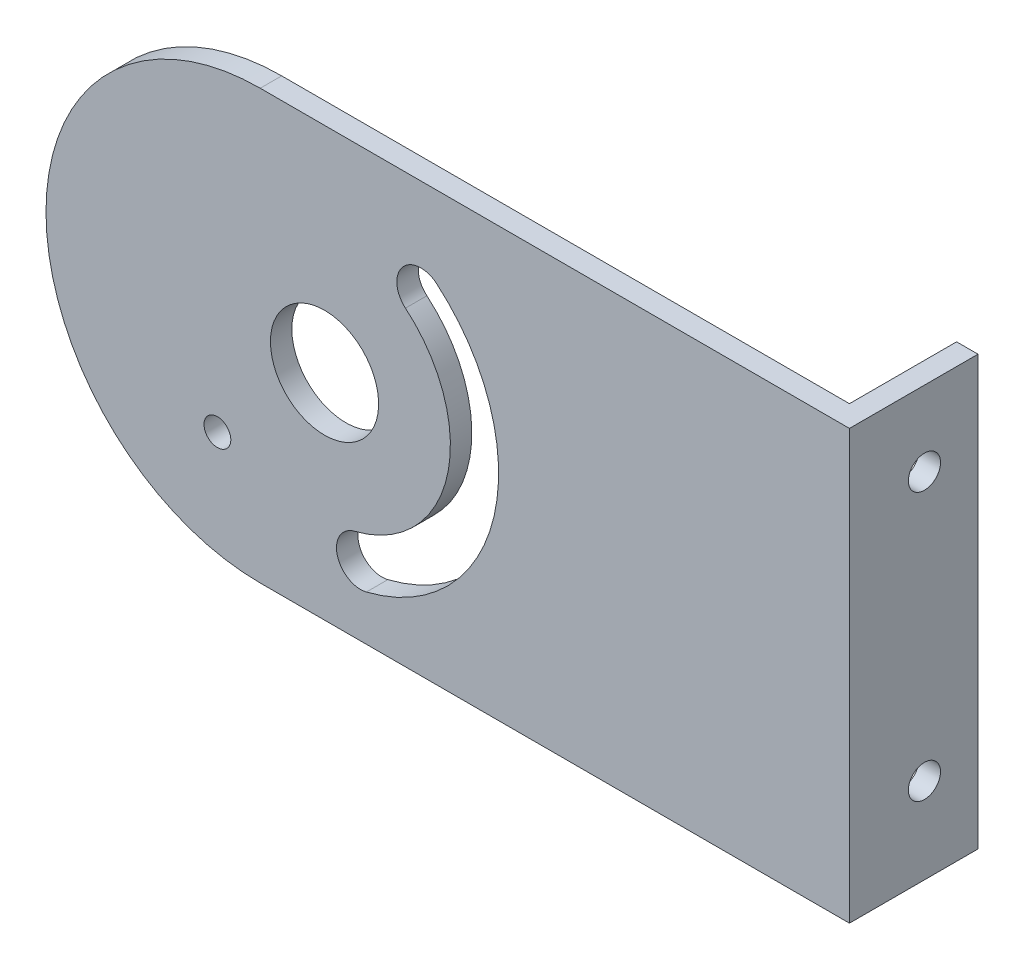
from build123d import *

# Parameters (mm, degrees)
SKETCH_2_W          = 75
SKETCH_2_H          = 40
EXTRUDE_1_DEPTH     = 2
SKETCH_3_R          = 5.05
SKETCH_3_R_2        = 1.25
CUT_EXTRUDE_1_DEPTH = 86.023526156
FILLET_1_R          = 20
SKETCH_7_W          = 2
SKETCH_7_H          = 40
EXTRUDE_3_DEPTH     = 10
SKETCH_10_R         = 1.5
CUT_EXTRUDE_4_DEPTH = 84.839131675


with BuildPart() as part:
    # 草图2 → 凸台-拉伸1 (new body)
    with BuildSketch(Plane.XY):
        with Locations((37.5, 20)):
            Rectangle(SKETCH_2_W, SKETCH_2_H)
    extrude(amount=EXTRUDE_1_DEPTH)

    # 草图3 → 切除-拉伸1 (cut, through all)
    with BuildSketch(Plane(origin=(0, 0, 0), x_dir=(-1, 0, 0), z_dir=(0, 0, -1))):
        with Locations((-26, 20)):
            Circle(SKETCH_3_R)
        with Locations((-16, 10.202041029)):
            Circle(SKETCH_3_R_2)
        with BuildLine():
            ThreePointArc((-36.446428571, 32.447274003), (-41.830655455, 16.332187591), (-29.908043377, 4.226931276))
            ThreePointArc((-29.908043377, 4.226931276), (-27.182966317, 5.86978094), (-28.82581598, 8.594858))
            ThreePointArc((-28.82581598, 8.594858), (-37.446781637, 17.347889489), (-33.553571429, 29.000336587))
            ThreePointArc((-33.553571429, 29.000336587), (-33.276531292, 32.170233866), (-36.446428571, 32.447274003))
        make_face()
    extrude(amount=-CUT_EXTRUDE_1_DEPTH, mode=Mode.SUBTRACT)

    # 圆角1
    fillet_1_edges = [part.edges().sort_by_distance(p)[0] for p in [
        (0, 40, 1),
        (0, 0, 1),
    ]]
    fillet(fillet_1_edges, radius=FILLET_1_R - 0.0001)  # a hair under: the kernel refuses the full size

    # 草图7 → 凸台-拉伸3 (add)
    with BuildSketch(Plane(origin=(0, 0, 0), x_dir=(-1, 0, 0), z_dir=(0, 0, -1))):
        with Locations((-74, 20)):
            Rectangle(SKETCH_7_W, SKETCH_7_H)
    extrude(amount=EXTRUDE_3_DEPTH)

    # 草图10 → 切除-拉伸4 (cut, through all)
    with BuildSketch(Plane.ZY.offset(-73)):
        with Locations((-5, 33)):
            Circle(SKETCH_10_R)
        with Locations((-5, 8)):
            Circle(SKETCH_10_R)
    extrude(amount=-CUT_EXTRUDE_4_DEPTH, mode=Mode.SUBTRACT)


solid = part.part
